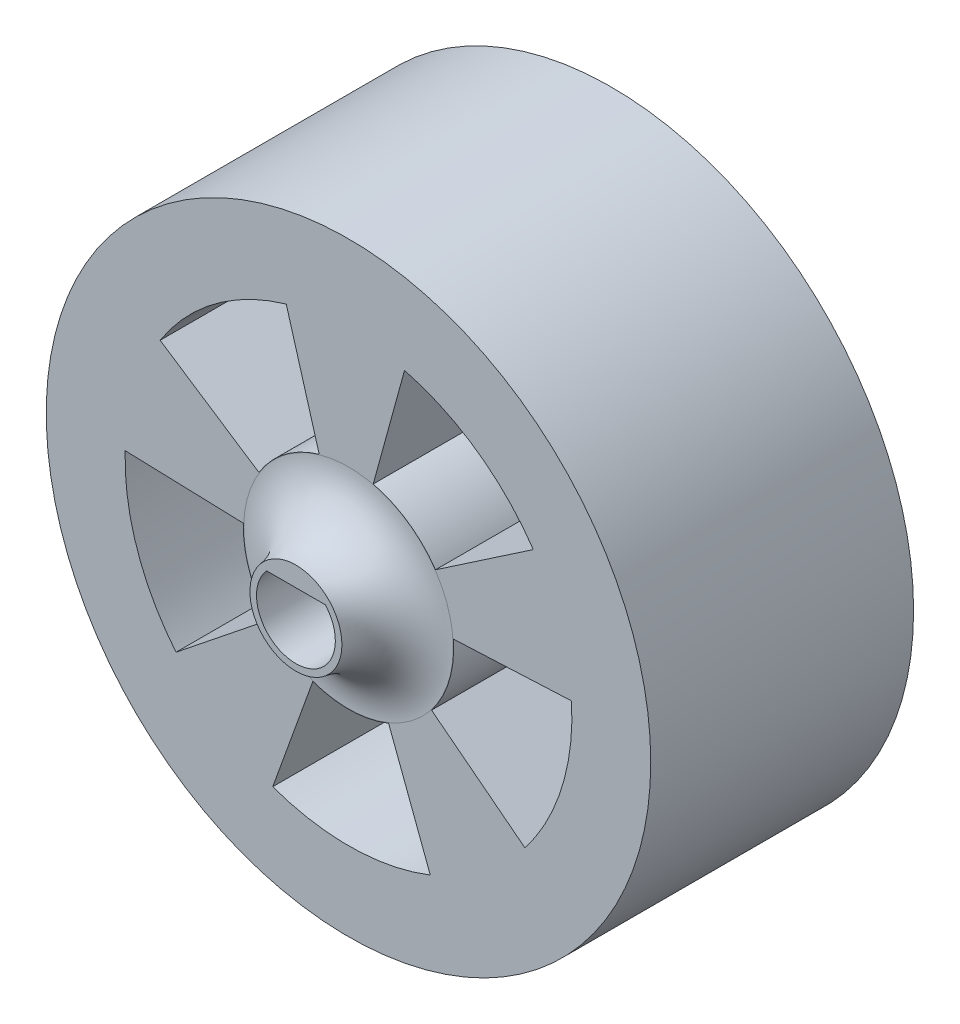
from build123d import *

# Parameters (mm, degrees)
SKETCH1_R           = 11.5
BOSS_EXTRUDE1_DEPTH = 10
SKETCH2_R           = 8.5
CUT_EXTRUDE2_DEPTH  = 10
SKETCH4_R           = 4
BOSS_EXTRUDE2_DEPTH = 10
BOSS_EXTRUDE3_START = 10
BOSS_EXTRUDE3_DEPTH = 10
CIRPATTERN1_COUNT   = 5
CUT_EXTRUDE4_DEPTH  = 10
SKETCH8_R           = 1.75
BOSS_EXTRUDE4_DEPTH = 2
CUT_EXTRUDE5_DEPTH  = 2
FILLET1_R           = 2.25


with BuildPart() as part:
    # Sketch1 → Boss-Extrude1 (new body)
    with BuildSketch(Plane.XY):
        Circle(SKETCH1_R)
    extrude(amount=BOSS_EXTRUDE1_DEPTH)

    # Sketch2 → Cut-Extrude2 (cut)
    with BuildSketch(Plane.XY.offset(10)):
        Circle(SKETCH2_R)
    extrude(amount=-CUT_EXTRUDE2_DEPTH, mode=Mode.SUBTRACT)



with BuildPart() as body_2:
    # Sketch4 → Boss-Extrude2 (new body)
    with BuildSketch(Plane.XY):
        Circle(SKETCH4_R)
    extrude(amount=BOSS_EXTRUDE2_DEPTH)


with BuildPart() as part_1:
    add(part.part)

    add(body_2.part)  # Boss-Extrude3 merges body 2
    # Sketch6 → Boss-Extrude3 (add)
    with BuildSketch(Plane.XY.offset(BOSS_EXTRUDE3_START)):
        with BuildLine():
            Line((-1.114437127, 3.841618134), (-2.368178894, 8.163438536))
            ThreePointArc((-2.368178894, 8.163438536), (-0.122551325, 8.499116494), (2.131821106, 8.228325393))
            Line((2.131821106, 8.228325393), (0.940332104, 3.887901173))
            ThreePointArc((0.940332104, 3.887901173), (-0.090075911, 3.998985663), (-1.114437127, 3.841618134))
        make_face()
    boss_extrude3 = extrude(amount=-BOSS_EXTRUDE3_DEPTH)

    # CirPattern1: Boss-Extrude3 ×5 about axis
    cirpattern1_axis = Axis((0, 0, 0), (0, 0, 1))
    for i in range(1, CIRPATTERN1_COUNT):
        add(boss_extrude3.rotate(cirpattern1_axis, i * 360 / CIRPATTERN1_COUNT))

    # Sketch7 → Cut-Extrude4 (cut)
    with BuildSketch(Plane.XY.offset(10)):
        with BuildLine():
            Line((-1.118033989, 1), (1.118033989, 1))
            ThreePointArc((1.118033989, 1), (0, -1.5), (-1.118033989, 1))
        make_face()
    extrude(amount=-CUT_EXTRUDE4_DEPTH, mode=Mode.SUBTRACT)

    # Sketch8 → Boss-Extrude4 (add)
    with BuildSketch(Plane.XY.offset(10)):
        Circle(SKETCH8_R)
    extrude(amount=BOSS_EXTRUDE4_DEPTH)

    # Sketch9 → Cut-Extrude5 (cut)
    with BuildSketch(Plane.XY.offset(12)):
        with BuildLine():
            Line((-1.118033989, 1), (1.118033989, 1))
            ThreePointArc((1.118033989, 1), (0, -1.5), (-1.118033989, 1))
        make_face()
    extrude(amount=-CUT_EXTRUDE5_DEPTH, mode=Mode.SUBTRACT)

    # Fillet1
    # the kernel refuses this fillet: 2.25 mm, written as the material it adds along each edge
    with BuildSketch(Plane(origin=(0, 0, 10), x_dir=(1, 0, 0), z_dir=(0, -1, 0))) as fillet1_piece_1:
        with BuildLine():
            CenterArc((3.986067977, 2.25), FILLET1_R, 186.379370208, 83.620629792)
            Line((1.75, 2), (1.70527864, 1.995))
            ThreePointArc((1.70527864, 1.995), (1.705, 1), (1.705, 0))
            Line((1.705, 0), (1.75, -0.045))
            Line((1.75, -0.045), (3.986067977, -0.045))
            Line((3.986067977, -0.045), (3.986067977, 0))
        make_face()
    revolve(axis=Axis((0, 0, 10), (0, 0, 1)))


solid = part_1.part
